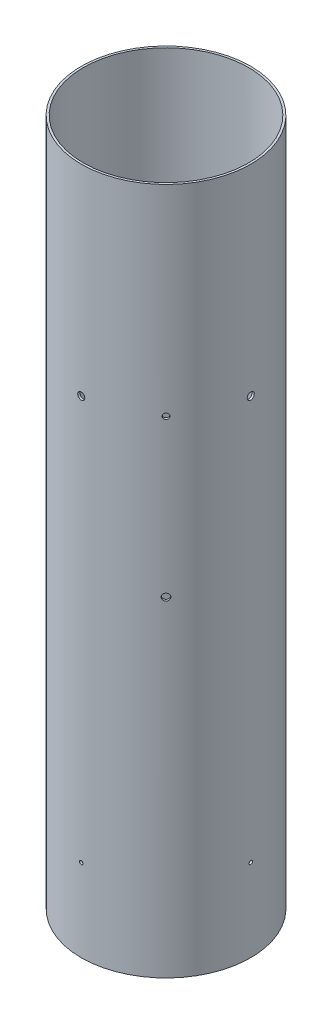
from build123d import *

# Parameters (mm, degrees)
SKETCH2_R                      = 78.359
SKETCH2_R_2                    = 76.3651
BOSS_EXTRUDE1_DEPTH            = 635
SKETCH4_R                      = 3.2639
CUT_EXTRUDE2_DEPTH             = 645.59697933
CIRPATTERN2_COUNT              = 4
CUT_EXTRUDE3_REACH             = 664.58
CUT_EXTRUDE3_END_RADIUS        = 76.3651
SKETCH5_R                      = 2.57937
CUT_EXTRUDE3_DIRECTION_2_DEPTH = 663.580045892
VENT_HOLE_REACH                = 708.654
VENT_HOLE_END_RADIUS           = 76.3651
SKETCH6_R                      = 3.175
F_4_CLEARANCE_HOLE1_D          = 3.2639
CIRPATTERN3_COUNT              = 2
CIRPATTERN3_ANGLE              = 90


with BuildPart() as part:
    # Sketch2 → Boss-Extrude1 (new body)
    with BuildSketch(Plane(origin=(0, 0, 0), x_dir=(1, 0, 0), z_dir=(0, 1, 0))):
        Circle(SKETCH2_R)
        Circle(SKETCH2_R_2, mode=Mode.SUBTRACT)
    extrude(amount=BOSS_EXTRUDE1_DEPTH)

    # Sketch4 → Cut-Extrude2 (cut, symmetric)
    with BuildSketch(Plane.XY):
        with Locations((0, 449.5038)):
            Circle(SKETCH4_R)
    cut_extrude2 = extrude(amount=CUT_EXTRUDE2_DEPTH, both=True, mode=Mode.SUBTRACT)

    # CirPattern2: Cut-Extrude2 ×4 about axis
    cirpattern2_axis = Axis((0, 635, 0), (0, 1, 0))
    for i in range(1, CIRPATTERN2_COUNT):
        add(cut_extrude2.rotate(cirpattern2_axis, i * 360 / CIRPATTERN2_COUNT), mode=Mode.SUBTRACT)

    # Cut-Extrude3: up to this cylinder (the profile starts outside it)
    cut_extrude3_end = Plane(origin=(0, 449.5038, 0), z_dir=(0, -1, 0)) * Cylinder(CUT_EXTRUDE3_END_RADIUS, 1482.8902, mode=Mode.PRIVATE)
    # Sketch5 → Cut-Extrude3 (cut, up to the surface)
    with BuildSketch(Plane(origin=(55.408180267, 0, 55.408180267), x_dir=(0, -1, 0), z_dir=(0.7071067811865488, 0, 0.7071067811865464)), mode=Mode.PRIVATE) as cut_extrude3_sk1:
        with Locations((-449.5038, 0)):
            Circle(SKETCH5_R)
    cut_extrude3_tool1 = extrude(cut_extrude3_sk1.sketch, amount=-CUT_EXTRUDE3_REACH, mode=Mode.PRIVATE) - cut_extrude3_end
    add(cut_extrude3_tool1.solids().sort_by_distance((55.40818, 449.5038, 55.40818))[0], mode=Mode.SUBTRACT)

    # Sketch5 → Cut-Extrude3 direction 2 (cut)
    with BuildSketch(Plane(origin=(55.408180267, 0, 55.408180267), x_dir=(0, -1, 0), z_dir=(0.7071067811865488, 0, 0.7071067811865464))):
        with Locations((-449.5038, 0)):
            Circle(SKETCH5_R)
    extrude(amount=CUT_EXTRUDE3_DIRECTION_2_DEPTH, mode=Mode.SUBTRACT)

    # Vent Hole: up to this cylinder (the profile starts outside it)
    vent_hole_end = Plane(origin=(0, 304.8, 0), z_dir=(0, -1, 0)) * Cylinder(VENT_HOLE_END_RADIUS, 1571.0382, mode=Mode.PRIVATE)
    # Sketch6 → Vent Hole (cut, up to the surface)
    with BuildSketch(Plane(origin=(189.175360534, 0, -78.359), x_dir=(-0.7071067811865464, 0, 0.7071067811865488), z_dir=(-0.7071067811865488, 0, -0.7071067811865464)), mode=Mode.PRIVATE) as vent_hole_sk1:
        with Locations((189.175360534, 304.8)):
            Circle(SKETCH6_R)
    vent_hole_tool1 = extrude(vent_hole_sk1.sketch, amount=VENT_HOLE_REACH, mode=Mode.PRIVATE) - vent_hole_end
    add(vent_hole_tool1.solids().sort_by_distance((55.40818, 304.8, 55.40818))[0], mode=Mode.SUBTRACT)

    # #4 Clearance Hole1 (through all)
    with Locations(Plane.XY.offset(78.359)):
        with Locations((0, 76.2)):
            f_4_clearance_hole1 = Hole(F_4_CLEARANCE_HOLE1_D / 2)

    # CirPattern3: #4 Clearance Hole1 ×2 about axis
    cirpattern3_axis = Axis((0, 0, 0), (0, 1, 0))
    for i in range(1, CIRPATTERN3_COUNT):
        add(f_4_clearance_hole1.rotate(cirpattern3_axis, i * CIRPATTERN3_ANGLE / (CIRPATTERN3_COUNT - 1)), mode=Mode.SUBTRACT)


solid = part.part
